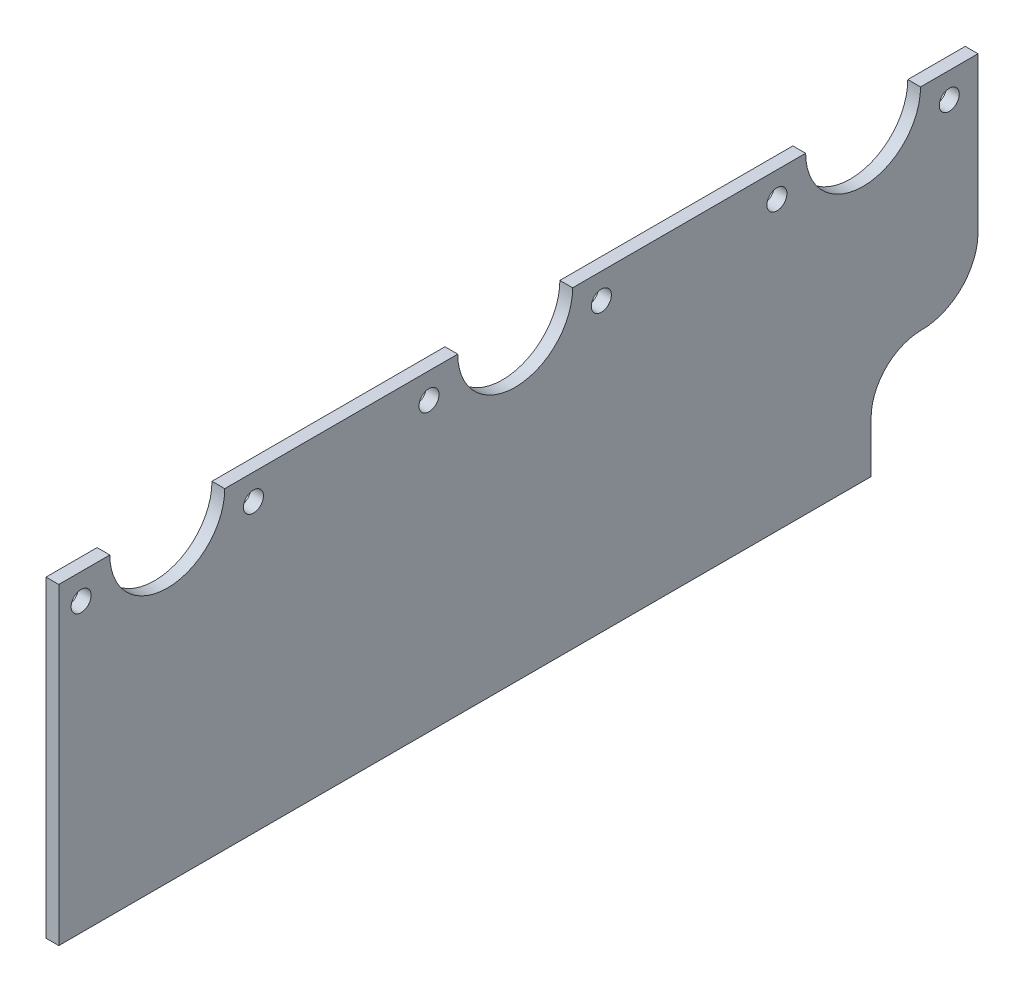
from build123d import *

# Parameters (mm, degrees)
BOSS_EXTRUDE1_DEPTH    = 3.175
F_10_CLEARANCE_HOLE1_D = 4.9784
CUT_EXTRUDE1_DEPTH     = 139.294850885


with BuildPart() as part:
    # Sketch1 → Boss-Extrude1 (new body)
    with BuildSketch(Plane(origin=(0, 0, 0), x_dir=(0, 0, -1), z_dir=(1, 0, 0))):
        with BuildLine():
            Line((114.3, 0), (-114.3, 0))
            Line((-114.3, 0), (-114.3, 77.7875))
            Line((-114.3, 77.7875), (-101.6, 77.7875))
            ThreePointArc((-101.6, 77.7875), (-87.3125, 63.5), (-73.025, 77.7875))
            Line((-73.025, 77.7875), (-15.08125, 77.7875))
            ThreePointArc((-15.08125, 77.7875), (-0.79375, 63.5), (13.49375, 77.7875))
            Line((13.49375, 77.7875), (71.4375, 77.7875))
            ThreePointArc((71.4375, 77.7875), (85.725, 63.5), (100.0125, 77.7875))
            Line((100.0125, 77.7875), (114.3, 77.7875))
            Line((114.3, 77.7875), (114.3, 0))
        make_face()
    extrude(amount=BOSS_EXTRUDE1_DEPTH)

    # #10 Clearance Hole1 (through all)
    with Locations(Plane(origin=(3.175, 0, 0), x_dir=(0, 0, -1), z_dir=(1, 0, 0))):
        with Locations((-108.74375, 71.4375), (-65.88125, 71.4375), (-22.225, 71.4375), (20.6375, 71.4375), (64.29375, 71.4375), (107.15625, 71.4375)):
            Hole(F_10_CLEARANCE_HOLE1_D / 2)

    # Sketch4 → Cut-Extrude1 (cut, through all)
    with BuildSketch(Plane.ZY):
        with BuildLine():
            Line((-87.7189, 12.7), (-87.7189, 0))
            Line((-87.7189, 0), (-114.3, 0))
            Line((-114.3, 0), (-114.3, 38.89375))
            ThreePointArc((-114.3, 38.89375), (-110.065913951, 29.268268394), (-100.323317526, 25.31109823))
            ThreePointArc((-100.323317526, 25.31109823), (-91.410243373, 21.615031404), (-87.7189, 12.7))
        make_face()
    extrude(amount=-CUT_EXTRUDE1_DEPTH, mode=Mode.SUBTRACT)


solid = part.part
